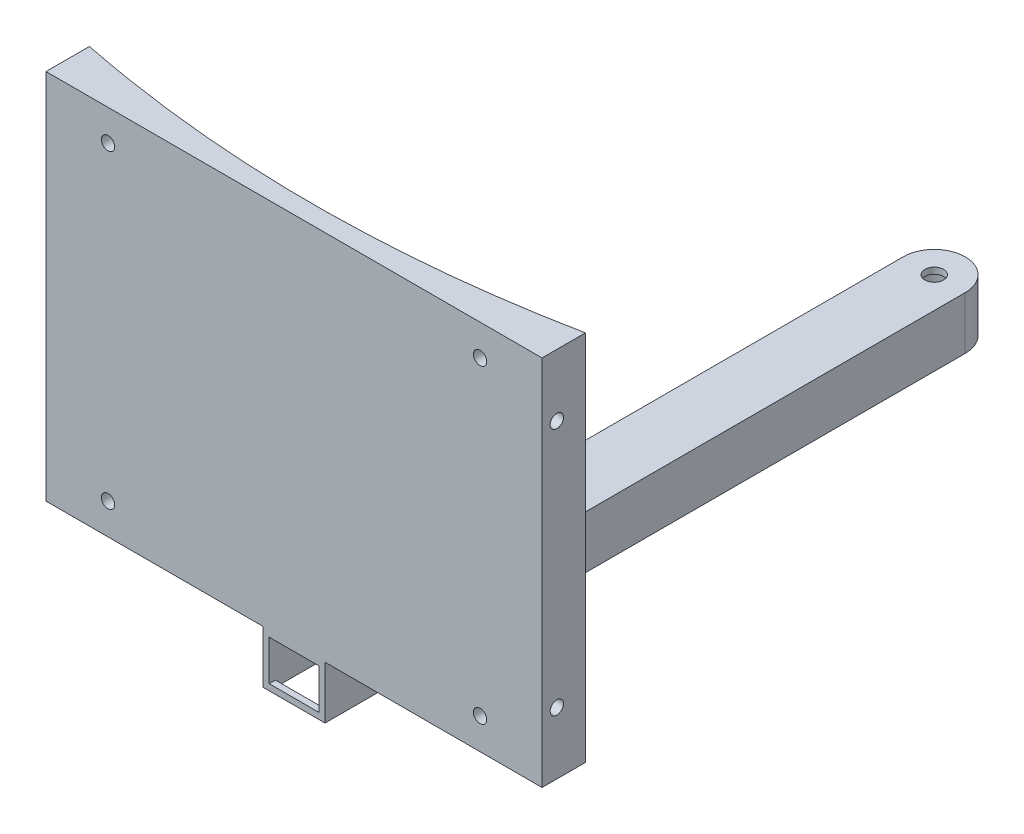
from build123d import *

# Parameters (mm, degrees)
BOSS_EXTRUDE3_DEPTH = 120
BOSS_EXTRUDE4_DEPTH = 2
BOSS_EXTRUDE5_DEPTH = 15
SKETCH8_W           = 16
SKETCH8_H           = 13
CUT_EXTRUDE2_DEPTH  = 15
SKETCH10_R          = 2.15
CUT_EXTRUDE3_DEPTH  = 10
SKETCH11_R          = 2.15
CUT_EXTRUDE4_DEPTH  = 7
SKETCH12_R          = 3
CUT_EXTRUDE5_DEPTH  = 7


with BuildPart() as part:
    # Sketch4 → Boss-Extrude3 (new body)
    with BuildSketch(Plane(origin=(0, 0, 0), x_dir=(1, 0, 0), z_dir=(0, 1, 0))):
        with BuildLine():
            Line((-80, -192.509889923), (-80, -206.5))
            Line((-80, -206.5), (80, -206.5))
            Line((80, -206.5), (80, -192.509889923))
            add(Edge.make_bspline(
                [(-80, -192.509889923), (-72.106688699, -194.086619514), (-45.4407372, -198.624917909), (0, -201.8200332), (45.4407372, -198.624917909), (72.106688699, -194.086619514), (80, -192.509889923)],
                knots=[0.498587518, 0.498587518, 0.498587518, 0.498587518, 0.499005631, 0.5, 0.500994369, 0.501412482, 0.501412482, 0.501412482, 0.501412482], degree=3))
        make_face()
    extrude(amount=BOSS_EXTRUDE3_DEPTH)

    # Sketch6 → Boss-Extrude4 (add)
    with BuildSketch(Plane.XZ):
        with BuildLine():
            Line((10, 0), (10, 206.5))
            Line((10, 206.5), (-10, 206.5))
            Line((-10, 206.5), (-10, 0))
            ThreePointArc((-10, 0), (0, -10), (10, 0))
        make_face()
    extrude(amount=BOSS_EXTRUDE4_DEPTH)

    # Sketch7 → Boss-Extrude5 (add)
    with BuildSketch(Plane.XZ.offset(2)):
        with BuildLine():
            Line((10, 0), (10, 206.5))
            Line((10, 206.5), (-10, 206.5))
            Line((-10, 206.5), (-10, 0))
            ThreePointArc((-10, 0), (0, -10), (10, 0))
        make_face()
        with BuildLine():
            Line((8, 0), (8, 204.5))
            Line((8, 204.5), (-8, 204.5))
            Line((-8, 204.5), (-8, 0))
            ThreePointArc((-8, 0), (0, -8), (8, 0))
        make_face(mode=Mode.SUBTRACT)
    extrude(amount=BOSS_EXTRUDE5_DEPTH)

    # Sketch8 → Cut-Extrude2 (cut)
    with BuildSketch(Plane.XY.offset(206.5)):
        with Locations((0, -8.5)):
            Rectangle(SKETCH8_W, SKETCH8_H)
    extrude(amount=-CUT_EXTRUDE2_DEPTH, mode=Mode.SUBTRACT)

    # Sketch10 → Cut-Extrude3 (cut)
    with BuildSketch(Plane(origin=(80, 0, 0), x_dir=(0, 0, -1), z_dir=(1, 0, 0))):
        with Locations((-201.72863576, 100)):
            Circle(SKETCH10_R)
        with Locations((-201.72863576, 20)):
            Circle(SKETCH10_R)
    cut_extrude3 = extrude(amount=-CUT_EXTRUDE3_DEPTH, mode=Mode.SUBTRACT)

    # Mirror1: Cut-Extrude3 across plane
    add(cut_extrude3.mirror(Plane(origin=(0, 0, 0), x_dir=(0, 0, 1), z_dir=(1, 0, 0))), mode=Mode.SUBTRACT)

    # Sketch11 → Cut-Extrude4 (cut)
    with BuildSketch(Plane.XY.offset(206.5)):
        with Locations((60, 110)):
            Circle(SKETCH11_R)
        with Locations((60, 10)):
            Circle(SKETCH11_R)
        with Locations((-60, 110)):
            Circle(SKETCH11_R)
        with Locations((-60, 10)):
            Circle(SKETCH11_R)
    extrude(amount=-CUT_EXTRUDE4_DEPTH, mode=Mode.SUBTRACT)

    # Sketch12 → Cut-Extrude5 (cut)
    with BuildSketch(Plane(origin=(0, 0, 0), x_dir=(1, 0, 0), z_dir=(0, 1, 0))):
        Circle(SKETCH12_R)
    extrude(amount=-CUT_EXTRUDE5_DEPTH, mode=Mode.SUBTRACT)


solid = part.part
